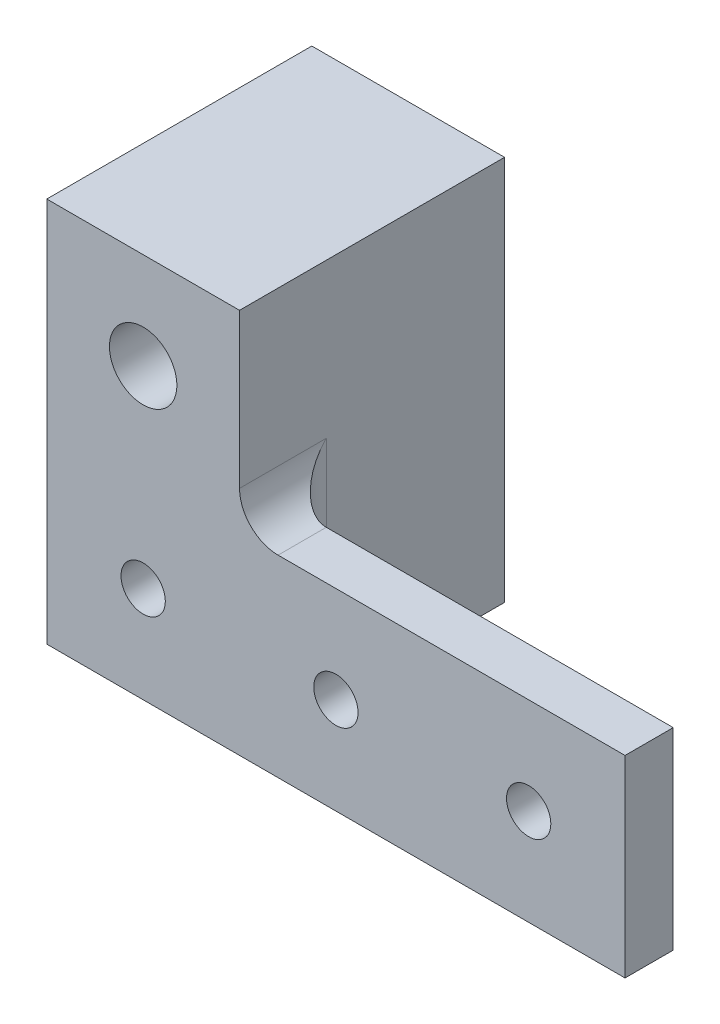
from build123d import *

# Parameters (mm, degrees)
BOSS_EXTRUDE1_DEPTH = 34.925
SKETCH2_R           = 2.921
CUT_EXTRUDE1_DEPTH  = 99.014466407
SKETCH4_W           = 50.8
SKETCH4_H           = 28.575
CUT_EXTRUDE3_DEPTH  = 99.014466407
FILLET1_R           = 5.08
SKETCH5_R           = 4.445
CUT_EXTRUDE4_DEPTH  = 22.225


with BuildPart() as part:
    # Sketch1 → Boss-Extrude1 (new body)
    with BuildSketch(Plane.XY):
        Polygon((0, 0), (0, 50.8), (25.4, 50.8), (25.4, 25.4), (76.2, 25.4), (76.2, 0), align=None)
    extrude(amount=BOSS_EXTRUDE1_DEPTH)

    # Sketch2 → Cut-Extrude1 (cut, through all)
    with BuildSketch(Plane.XY.offset(34.925)):
        with Locations((12.7, 38.1)):
            Circle(SKETCH2_R)
        with Locations((12.7, 12.7)):
            Circle(SKETCH2_R)
        with Locations((38.1, 12.7)):
            Circle(SKETCH2_R)
        with Locations((63.5, 12.7)):
            Circle(SKETCH2_R)
    extrude(amount=-CUT_EXTRUDE1_DEPTH, mode=Mode.SUBTRACT)

    # Sketch4 → Cut-Extrude3 (cut, through all)
    with BuildSketch(Plane.XZ):
        with Locations((50.8, 14.2875)):
            Rectangle(SKETCH4_W, SKETCH4_H)
    extrude(amount=-CUT_EXTRUDE3_DEPTH, mode=Mode.SUBTRACT)

    # Fillet1
    fillet1_edges = [part.edges().sort_by_distance(p)[0] for p in [
        (25.4, 12.7, 28.575),
        (25.4, 25.4, 31.75),
    ]]
    fillet(fillet1_edges, radius=FILLET1_R)

    # Sketch5 → Cut-Extrude4 (cut)
    with BuildSketch(Plane.XY.offset(34.925)):
        with Locations((12.7, 38.1)):
            Circle(SKETCH5_R)
    extrude(amount=-CUT_EXTRUDE4_DEPTH, mode=Mode.SUBTRACT)


solid = part.part
